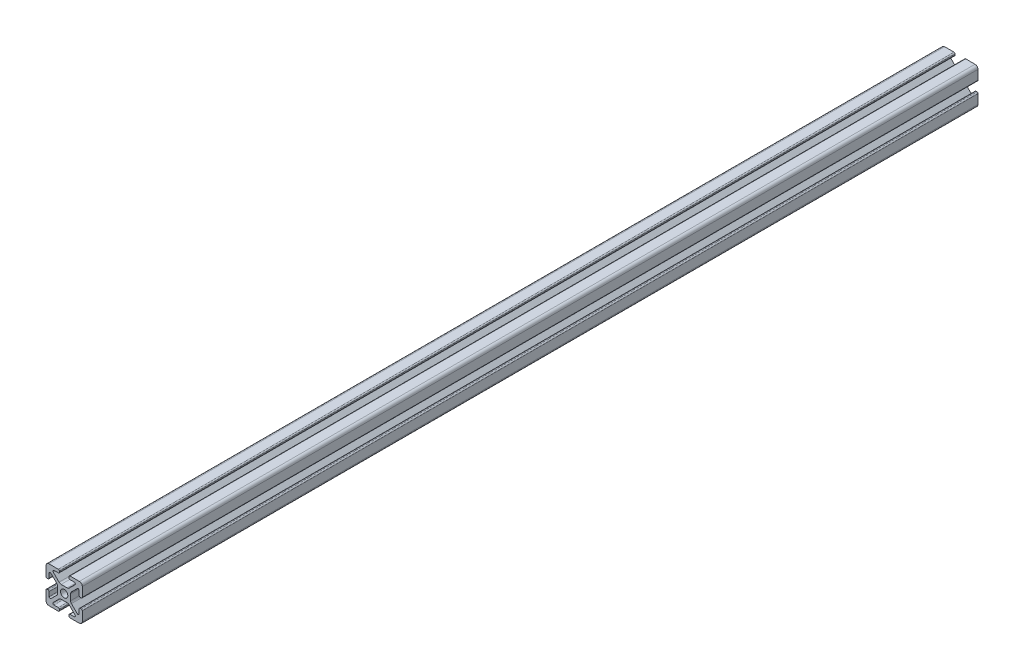
from build123d import *

# Parameters (mm, degrees)
SKETCH2_W            = 8.76
SKETCH2_H            = 8.76
SKETCH2_R            = 2.5
BOSS_EXTRUDE1_DEPTH  = 304.8
BOSS_EXTRUDE2_START  = -304.8
BOSS_EXTRUDE2_DEPTH  = 609.6
FILLET1_R            = 0.75
FILLET1_OF_MIRROR1_R = 0.75
MIRROR2_START        = -304.8
MIRROR2_DEPTH        = 609.6
FILLET2_R            = 2


# Read off the part's stored shape, not the designer's step: Mirror2
with BuildPart() as part:
    # Sketch2 → Boss-Extrude1 (new, symmetric)
    with BuildSketch(Plane.XY):
        Rectangle(SKETCH2_W, SKETCH2_H)
        with Locations(Location((0, 0, 0), (0, 0, 180))):
            Circle(SKETCH2_R, mode=Mode.SUBTRACT)
    extrude(amount=BOSS_EXTRUDE1_DEPTH, both=True)

    # Sketch3 → Boss-Extrude2 (add)
    with BuildSketch(Plane.XY.offset(BOSS_EXTRUDE2_START)):
        Polygon((3.25, 12.35), (12.35, 12.35), (12.35, 3.25), (10.22, 3.25), (10.22, 8.713862556), (4.38, 2.873862556), (4.38, 4.38), (2.873862556, 4.38), (8.713862556, 10.22), (3.25, 10.22), align=None)
    boss_extrude2 = extrude(amount=BOSS_EXTRUDE2_DEPTH)

    # Fillet1
    fillet1_edges = [part.edges().sort_by_distance(p)[0] for p in [
        (3.25, 12.35, 0),
        (3.25, 10.22, 0),
        (8.713862556, 10.22, 0),
        (10.22, 8.713862556, 0),
        (10.22, 3.25, 0),
        (12.35, 3.25, 0),
    ]]
    fillet(fillet1_edges, radius=FILLET1_R)

    # Mirror1: Boss-Extrude2 across plane
    add(boss_extrude2.mirror(Plane.ZX))

    # Fillet1 of Mirror1
    fillet1_of_mirror1_edges = [part.edges().sort_by_distance(p)[0] for p in [
        (3.25, -12.35, 0),
        (3.25, -10.22, 0),
        (8.713862556, -10.22, 0),
        (10.22, -8.713862556, 0),
        (10.22, -3.25, 0),
        (12.35, -3.25, 0),
    ]]
    fillet(fillet1_of_mirror1_edges, radius=FILLET1_OF_MIRROR1_R)

    # Mirror2 outline → Mirror2 (add)
    with BuildSketch(Plane.XY.offset(MIRROR2_START)):
        with BuildLine():
            ThreePointArc((-7.43353247, 8.939669914), (-7.596112034, 9.757012574), (-6.903202384, 10.22))
            Line((-6.903202384, 10.22), (-4, 10.22))
            ThreePointArc((-4, 10.22), (-3.469669914, 10.439669914), (-3.25, 10.97))
            Line((-3.25, 10.97), (-3.25, 11.6))
            ThreePointArc((-3.25, 11.6), (-3.469669914, 12.130330086), (-4, 12.35))
            Line((-4, 12.35), (-12.35, 12.35))
            Line((-12.35, 12.35), (-12.35, 4))
            ThreePointArc((-12.35, 4), (-12.130330086, 3.469669914), (-11.6, 3.25))
            Line((-11.6, 3.25), (-10.97, 3.25))
            ThreePointArc((-10.97, 3.25), (-10.439669914, 3.469669914), (-10.22, 4))
            Line((-10.22, 4), (-10.22, 6.903202384))
            ThreePointArc((-10.22, 6.903202384), (-9.757012574, 7.596112034), (-8.939669914, 7.43353247))
            Line((-8.939669914, 7.43353247), (-4.38, 2.873862556))
            Line((-4.38, 2.873862556), (-4.38, 4.38))
            Line((-4.38, 4.38), (-2.873862556, 4.38))
            Line((-2.873862556, 4.38), (-7.43353247, 8.939669914))
        make_face()
        with BuildLine():
            Line((-4.38, -4.38), (-4.38, -2.873862556))
            Line((-4.38, -2.873862556), (-8.939669914, -7.43353247))
            ThreePointArc((-8.939669914, -7.43353247), (-9.757012574, -7.596112034), (-10.22, -6.903202384))
            Line((-10.22, -6.903202384), (-10.22, -4))
            ThreePointArc((-10.22, -4), (-10.439669914, -3.469669914), (-10.97, -3.25))
            Line((-10.97, -3.25), (-11.6, -3.25))
            ThreePointArc((-11.6, -3.25), (-12.130330086, -3.469669914), (-12.35, -4))
            Line((-12.35, -4), (-12.35, -12.35))
            Line((-12.35, -12.35), (-4, -12.35))
            ThreePointArc((-4, -12.35), (-3.469669914, -12.130330086), (-3.25, -11.6))
            Line((-3.25, -11.6), (-3.25, -10.97))
            ThreePointArc((-3.25, -10.97), (-3.469669914, -10.439669914), (-4, -10.22))
            Line((-4, -10.22), (-6.903202384, -10.22))
            ThreePointArc((-6.903202384, -10.22), (-7.596112034, -9.757012574), (-7.43353247, -8.939669914))
            Line((-7.43353247, -8.939669914), (-2.873862556, -4.38))
            Line((-2.873862556, -4.38), (-4.38, -4.38))
        make_face()
    extrude(amount=MIRROR2_DEPTH)

    # Fillet2
    fillet2_edges = [part.edges().sort_by_distance(p)[0] for p in [
        (-2.873862556, -4.38, 0),
        (-4.38, -2.873862556, 0),
        (-12.35, -12.35, 0),
        (2.873862556, 4.38, 0),
        (4.38, 2.873862556, 0),
        (12.35, 12.35, 0),
        (-2.873862556, 4.38, 0),
        (-4.38, 2.873862556, 0),
        (-12.35, 12.35, 0),
        (2.873862556, -4.38, 0),
        (4.38, -2.873862556, 0),
        (12.35, -12.35, 0),
    ]]
    fillet(fillet2_edges, radius=FILLET2_R)


solid = part.part
